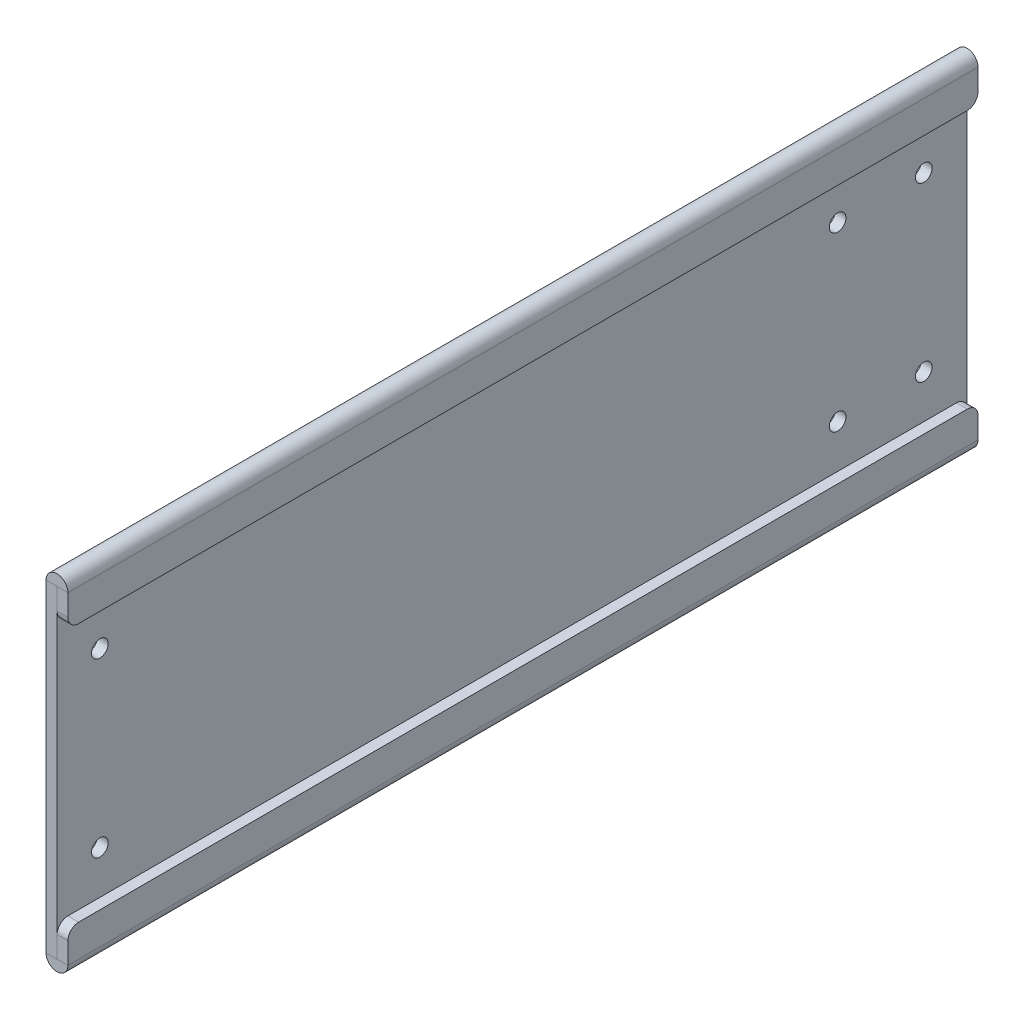
from build123d import *

# Parameters (mm, degrees)
SKETCH1_W          = 3.175
SKETCH1_H          = 268.22908
BASE_FLANGE1_DEPTH = 101.6
HEM1_START         = -268.22908
HEM1_DEPTH         = 268.22908
HEM1_2_DEPTH       = 268.22908
SKETCH10_R         = 2.45745
CUT_EXTRUDE1_DEPTH = 287.898940147
FILLET1_R          = 3.175


# Read off the part's stored shape, not the designer's step: Hem1
# Sheet-metal steps are written as plain solids
with BuildPart() as part:
    # Sketch1 → Base-Flange1 (new body)
    with BuildSketch(Plane(origin=(0, 0, 0), x_dir=(1, 0, 0), z_dir=(0, 1, 0))):
        with Locations((1.5875, 134.11454)):
            Rectangle(SKETCH1_W, SKETCH1_H)
    extrude(amount=BASE_FLANGE1_DEPTH)

    # Hem1 outline → Hem1 (cut)
    with BuildSketch(Plane.XY.offset(HEM1_START)):
        with BuildLine():
            ThreePointArc((0, 98.375), (0.926970953, 100.637672645), (3.175, 101.59961238))
            Line((3.175, 101.59961238), (3.175, 101.6))
            Line((3.175, 101.6), (0, 101.6))
            Line((0, 101.6), (0, 98.375))
        make_face()
        with BuildLine():
            ThreePointArc((3.175, 0.00038762), (0.926970953, 0.962327355), (0, 3.225))
            Line((0, 3.225), (0, 0))
            Line((0, 0), (3.175, 0))
            Line((3.175, 0), (3.175, 0.00038762))
        make_face()
    extrude(amount=HEM1_DEPTH, mode=Mode.SUBTRACT)

    # Hem1 2 outline → Hem1 2 (add)
    with BuildSketch(Plane.XY.offset(HEM1_START)):
        with BuildLine():
            Line((3.275, 88.9), (6.45, 88.9))
            Line((6.45, 88.9), (6.45, 98.375))
            ThreePointArc((6.45, 98.375), (5.487672645, 100.673029047), (3.175, 101.59961238))
            Line((3.175, 101.59961238), (3.175, 98.375))
            ThreePointArc((3.175, 98.375), (3.225, 98.425), (3.275, 98.375))
            Line((3.275, 98.375), (3.275, 88.9))
        make_face()
        with BuildLine():
            ThreePointArc((3.275, 3.225), (3.225, 3.175), (3.175, 3.225))
            Line((3.175, 3.225), (3.175, 0.00038762))
            ThreePointArc((3.175, 0.00038762), (5.487672645, 0.926970953), (6.45, 3.225))
            Line((6.45, 3.225), (6.45, 12.7))
            Line((6.45, 12.7), (3.275, 12.7))
            Line((3.275, 12.7), (3.275, 3.225))
        make_face()
    extrude(amount=HEM1_2_DEPTH)

    # Sketch10 → Cut-Extrude1 (cut, through all)
    with BuildSketch(Plane.ZY):
        with Locations((-255.52908, 76.15)):
            Circle(SKETCH10_R)
        with Locations((-255.52908, 25.35)):
            Circle(SKETCH10_R)
        with Locations((-230.12908, 25.35)):
            Circle(SKETCH10_R)
        with Locations((-230.12908, 76.15)):
            Circle(SKETCH10_R)
        with Locations((-12.7, 76.15)):
            Circle(SKETCH10_R)
        with Locations((-12.7, 25.35)):
            Circle(SKETCH10_R)
    extrude(amount=-CUT_EXTRUDE1_DEPTH, mode=Mode.SUBTRACT)

    # Fillet1
    fillet1_edges = [part.edges().sort_by_distance(p)[0] for p in [
        (4.8625, 88.9, 0),
        (4.8625, 88.9, -268.22908),
        (4.8625, 12.7, -268.22908),
        (4.8625, 12.7, 0),
    ]]
    fillet(fillet1_edges, radius=FILLET1_R)


solid = part.part
